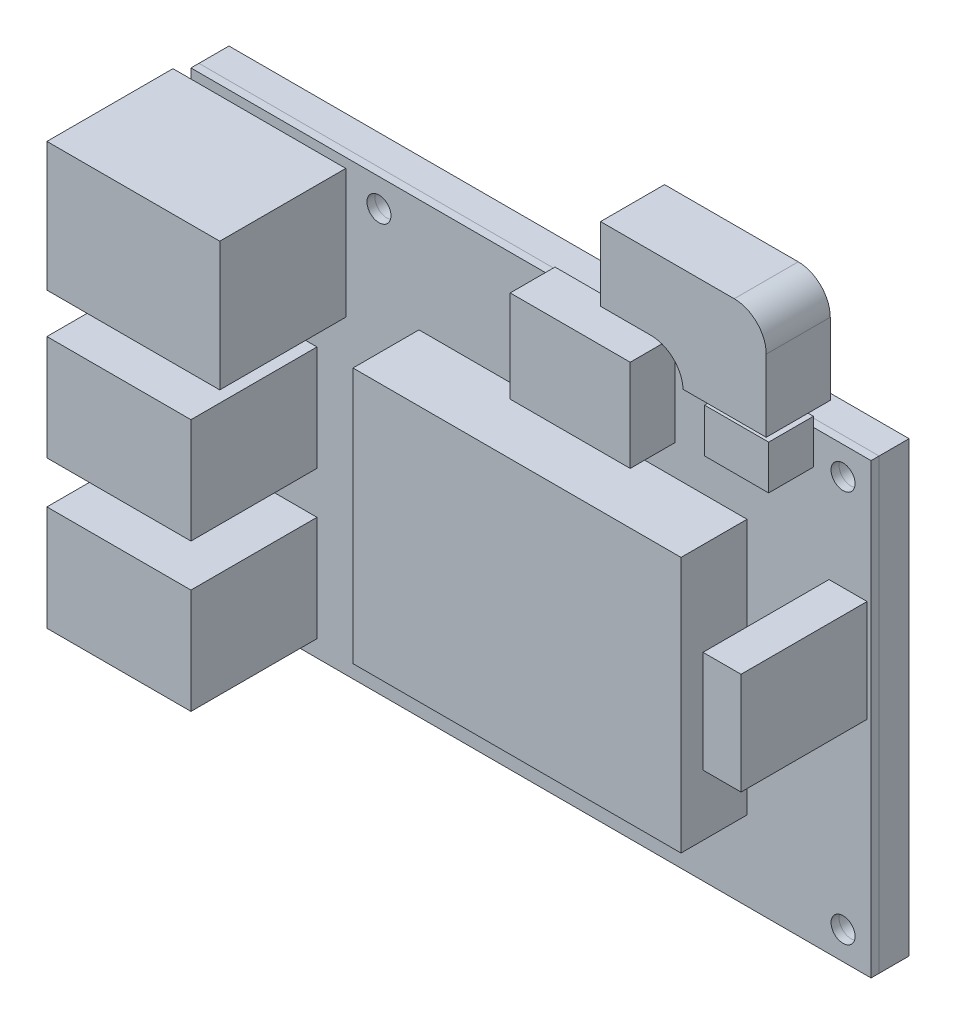
from build123d import *

# Parameters (mm, degrees)
SKETCH1_W           = 85
SKETCH1_H           = 56
SKETCH1_R           = 1.5
BOSS_EXTRUDE1_DEPTH = 1
SKETCH1_2_W         = 85
SKETCH1_2_H         = 56
SKETCH1_2_R         = 1.5
BOSS_EXTRUDE2_DEPTH = 3.75
SKETCH3_W           = 41
SKETCH3_H           = 32
BOSS_EXTRUDE3_DEPTH = 8.25
SKETCH4_W           = 18
SKETCH4_H           = 13.14
SKETCH4_W_2         = 4.755
SKETCH4_H_2         = 12.75
SKETCH4_W_3         = 21.6
SKETCH4_H_3         = 16.1
BOSS_EXTRUDE4_DEPTH = 15.75
SKETCH5_W           = 15
SKETCH5_H           = 11.5
SKETCH5_W_2         = 8
SKETCH5_H_2         = 5.5
BOSS_EXTRUDE5_DEPTH = 5.6
SKETCH6_W           = 11.61
SKETCH6_H           = 15.75
BOSS_EXTRUDE6_DEPTH = 4
BOSS_EXTRUDE7_DEPTH = 8
FILLET1_R           = 4


with BuildPart() as part:
    # Sketch1 → Boss-Extrude1 (new body)
    with BuildSketch(Plane.XY):
        Rectangle(SKETCH1_W, SKETCH1_H)
        with Locations((-19.000000078, 24.5)):
            Circle(SKETCH1_R, mode=Mode.SUBTRACT)
        with Locations((-19.000000078, -24.5)):
            Circle(SKETCH1_R, mode=Mode.SUBTRACT)
        with Locations((39, 24.5)):
            Circle(SKETCH1_R, mode=Mode.SUBTRACT)
        with Locations((39, -24.5)):
            Circle(SKETCH1_R, mode=Mode.SUBTRACT)
    extrude(amount=BOSS_EXTRUDE1_DEPTH)

    # Sketch3 → Boss-Extrude3 (add)
    with BuildSketch(Plane.XY.offset(1)):
        with Locations((6.5, -2.1)):
            Rectangle(SKETCH3_W, SKETCH3_H)
    extrude(amount=BOSS_EXTRUDE3_DEPTH)

    # Sketch4 → Boss-Extrude4 (add)
    with BuildSketch(Plane.XY.offset(1)):
        with Locations((-35.74947609, -0.89)):
            Rectangle(SKETCH4_W, SKETCH4_H)
        with Locations((-35.74947609, -19.33)):
            Rectangle(SKETCH4_W, SKETCH4_H)
        with Locations((39.6225, 6.125)):
            Rectangle(SKETCH4_W_2, SKETCH4_H_2)
        with Locations((-33.94947609, 18.75)):
            Rectangle(SKETCH4_W_3, SKETCH4_H_3)
    extrude(amount=BOSS_EXTRUDE4_DEPTH)

    # Sketch5 → Boss-Extrude5 (add)
    with BuildSketch(Plane.XY.offset(1)):
        with Locations((10.5, 23.45)):
            Rectangle(SKETCH5_W, SKETCH5_H)
        with Locations((31.3, 26.45)):
            Rectangle(SKETCH5_W_2, SKETCH5_H_2)
    extrude(amount=BOSS_EXTRUDE5_DEPTH)


with BuildPart() as body_2:
    # Sketch1<2> → Boss-Extrude2 (new body)
    with BuildSketch(Plane.XY):
        Rectangle(SKETCH1_2_W, SKETCH1_2_H)
        with Locations((-19.000000078, 24.5)):
            Circle(SKETCH1_2_R, mode=Mode.SUBTRACT)
        with Locations((-19.000000078, -24.5)):
            Circle(SKETCH1_2_R, mode=Mode.SUBTRACT)
        with Locations((39, 24.5)):
            Circle(SKETCH1_2_R, mode=Mode.SUBTRACT)
        with Locations((39, -24.5)):
            Circle(SKETCH1_2_R, mode=Mode.SUBTRACT)
    extrude(amount=-BOSS_EXTRUDE2_DEPTH)


with BuildPart() as body_3:
    # Sketch6 → Boss-Extrude6 (new body)
    with BuildSketch(Plane.XY):
        with Locations((-6.401910681, -20.625)):
            Rectangle(SKETCH6_W, SKETCH6_H)
    extrude(amount=-BOSS_EXTRUDE6_DEPTH)


with BuildPart() as body_4:
    # Sketch7 → Boss-Extrude7 (new body)
    with BuildSketch(Plane.XY):
        Polygon((36.399565533, 30.969563873), (36.399565533, 43.969563873), (15.69055196, 43.969563873), (15.69055196, 34.798856494), (26.0068166, 34.798856494), (26.0068166, 30.969563873), align=None)
    extrude(amount=BOSS_EXTRUDE7_DEPTH)

    # Fillet1
    # the kernel refuses this fillet: 4 mm, written as the material it adds along each edge
    with BuildSketch(Plane(origin=(26.0068166, 34.798856494, 0), x_dir=(-1, 0, 0), z_dir=(0, 0, 1))) as fillet1_piece_1:
        with BuildLine():
            CenterArc((3.996355714, 4), FILLET1_R, 182.445945938, 87.554054062)
            Line((0, 3.829292621), (0, 0))
            Line((0, 0), (3.996355714, 0))
        make_face()
    extrude(amount=8)
    # the kernel refuses this fillet: 4 mm, written as the material it takes off along each edge
    with BuildSketch(Plane(origin=(36.399565533, 43.969563873, -10), x_dir=(0, -1, 0), z_dir=(0, 0, 1))) as fillet1_2_piece_1:
        with BuildLine():
            CenterArc((FILLET1_R, -FILLET1_R), FILLET1_R, 90, 90)
            Line((0, -FILLET1_R), (0, 0))
            Line((0, 0), (FILLET1_R, 0))
        make_face()
    extrude(amount=28, mode=Mode.SUBTRACT)


solid = Compound([part.part, body_2.part, body_3.part, body_4.part])
